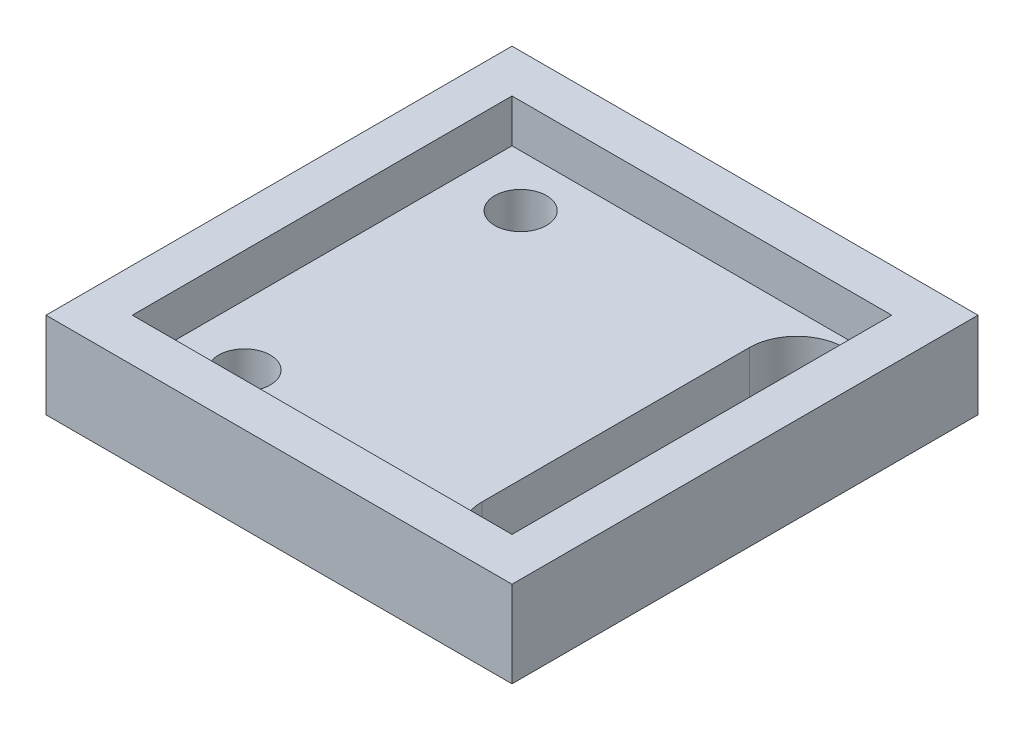
from build123d import *

# Parameters (mm, degrees)
SKETCH2_W           = 27
SKETCH2_H           = 27
BOSS_EXTRUDE1_DEPTH = 5
SKETCH5_W           = 22
SKETCH5_H           = 22
CUT_EXTRUDE2_DEPTH  = 2.5
SKETCH3_R           = 1.5
CUT_EXTRUDE3_DEPTH  = 10
CUT_EXTRUDE4_DEPTH  = 10


with BuildPart() as part:
    # Sketch2 → Boss-Extrude1 (new body)
    with BuildSketch(Plane(origin=(0, 0, 0), x_dir=(1, 0, 0), z_dir=(0, 1, 0))):
        with Locations((13.5, 13.5)):
            Rectangle(SKETCH2_W, SKETCH2_H)
    extrude(amount=BOSS_EXTRUDE1_DEPTH)

    # Sketch5 → Cut-Extrude2 (cut)
    with BuildSketch(Plane(origin=(0, 5, 0), x_dir=(1, 0, 0), z_dir=(0, 1, 0))):
        with Locations((13.5, 13.5)):
            Rectangle(SKETCH5_W, SKETCH5_H)
    extrude(amount=-CUT_EXTRUDE2_DEPTH, mode=Mode.SUBTRACT)

    # Sketch3 → Cut-Extrude3 (cut)
    with BuildSketch(Plane(origin=(0, 0, 0), x_dir=(-1, 0, 0), z_dir=(0, -1, 0))):
        with Locations((-6, 21.5)):
            Circle(SKETCH3_R)
        with Locations((-6, 5.5)):
            Circle(SKETCH3_R)
    extrude(amount=-CUT_EXTRUDE3_DEPTH, mode=Mode.SUBTRACT)

    # Sketch6 → Cut-Extrude4 (cut)
    with BuildSketch(Plane(origin=(0, 2.5, 0), x_dir=(1, 0, 0), z_dir=(0, 1, 0))):
        with BuildLine():
            ThreePointArc((22.25, 24), (20.305456352, 23.194543648), (19.5, 21.25))
            Line((19.5, 21.25), (19.5, 5.75))
            ThreePointArc((19.5, 5.75), (20.305456352, 3.805456352), (22.25, 3))
            ThreePointArc((22.25, 3), (23.865824645, 3.9734162), (24.5, 5.75))
            Line((24.5, 5.75), (24.5, 21.25))
            ThreePointArc((24.5, 21.25), (23.865824645, 23.0265838), (22.25, 24))
        make_face()
    extrude(amount=-CUT_EXTRUDE4_DEPTH, mode=Mode.SUBTRACT)


solid = part.part
